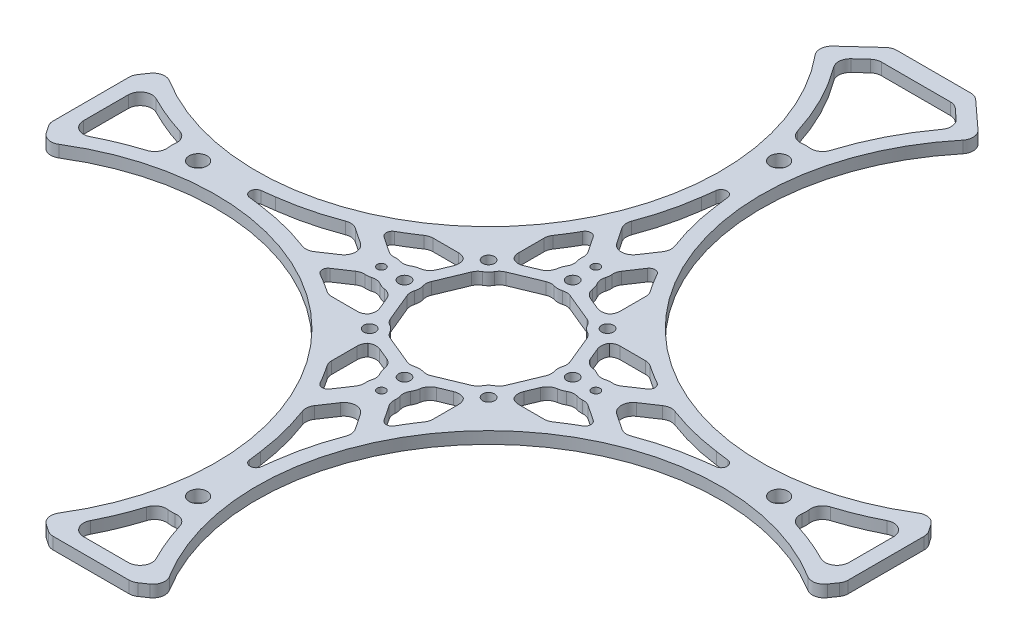
from build123d import *

# Parameters (mm, degrees)
SKETCH_1_R      = 1.5
SKETCH_1_R_2    = 1
SKETCH_1_R_3    = 0.7
EXTRUDE_1_DEPTH = 2
FILLET_1_R      = 2
FILLET_2_R      = 1
FILLET_3_R      = 2


with BuildPart() as part:
    # 草图1 → 凸台-拉伸1 (new body)
    with BuildSketch(Plane(origin=(0, 0, 0), x_dir=(1, 0, 0), z_dir=(0, 1, 0))):
        with BuildLine():
            Line((66.853027267, -7), (64.564685006, -10.318827685))
            ThreePointArc((64.564685006, -10.318827685), (14.849242405, -14.849242405), (10.318827685, -64.564685006))
            Line((10.318827685, -64.564685006), (7, -66.853027267))
            Line((7, -66.853027267), (-7, -66.853027267))
            Line((-7, -66.853027267), (-10.318827685, -64.564685006))
            ThreePointArc((-10.318827685, -64.564685006), (-14.849242405, -14.849242405), (-64.564685006, -10.318827685))
            Line((-64.564685006, -10.318827685), (-66.853027267, -7))
            Line((-66.853027267, -7), (-66.853027267, 7))
            Line((-66.853027267, 7), (-64.564685006, 10.318827685))
            ThreePointArc((-64.564685006, 10.318827685), (-13.01911022, 16.809791852), (-13.65827776, 68.758520043))
            Line((-13.65827776, 68.758520043), (-7, 74.853027267))
            Line((-7, 74.853027267), (7, 74.853027267))
            Line((7, 74.853027267), (13.65827776, 68.758520043))
            ThreePointArc((13.65827776, 68.758520043), (13.01911022, 16.809791852), (64.564685006, 10.318827685))
            Line((64.564685006, 10.318827685), (66.853027267, 7))
            Line((66.853027267, 7), (66.853027267, -7))
        make_face()
        with Locations(Location((0, 48.853027267, 0), (0, 0, 270))):
            Circle(SKETCH_1_R, mode=Mode.SUBTRACT)
        with Locations(Location((10, 10, 0), (0, 0, 270))):
            Circle(SKETCH_1_R_2, mode=Mode.SUBTRACT)
        with Locations(Location((0, 14.142135624, 0), (0, 0, 270))):
            Circle(SKETCH_1_R_2, mode=Mode.SUBTRACT)
        with Locations(Location((0, 18.03122292, 0), (0, 0, 270))):
            Circle(SKETCH_1_R_3, mode=Mode.SUBTRACT)
        with Locations(Location((-10, 10, 0), (0, 0, 270))):
            Circle(SKETCH_1_R_2, mode=Mode.SUBTRACT)
        with Locations(Location((10, -10, 0), (0, 0, 270))):
            Circle(SKETCH_1_R_2, mode=Mode.SUBTRACT)
        with Locations(Location((18.03122292, 0, 0), (0, 0, 270))):
            Circle(SKETCH_1_R_3, mode=Mode.SUBTRACT)
        with Locations(Location((14.142135624, 0, 0), (0, 0, 270))):
            Circle(SKETCH_1_R_2, mode=Mode.SUBTRACT)
        with Locations(Location((48.853027267, 0, 0), (0, 0, 270))):
            Circle(SKETCH_1_R, mode=Mode.SUBTRACT)
        with Locations(Location((0, -48.853027267, 0), (0, 0, 270))):
            Circle(SKETCH_1_R, mode=Mode.SUBTRACT)
        with Locations(Location((0, -14.142135624, 0), (0, 0, 270))):
            Circle(SKETCH_1_R_2, mode=Mode.SUBTRACT)
        with Locations(Location((0, -18.03122292, 0), (0, 0, 270))):
            Circle(SKETCH_1_R_3, mode=Mode.SUBTRACT)
        with Locations(Location((-18.03122292, 0, 0), (0, 0, 270))):
            Circle(SKETCH_1_R_3, mode=Mode.SUBTRACT)
        with Locations(Location((-14.142135624, 0, 0), (0, 0, 270))):
            Circle(SKETCH_1_R_2, mode=Mode.SUBTRACT)
        with Locations(Location((-10, -10, 0), (0, 0, 270))):
            Circle(SKETCH_1_R_2, mode=Mode.SUBTRACT)
        with Locations(Location((-48.853027267, 0, 0), (0, 0, 270))):
            Circle(SKETCH_1_R, mode=Mode.SUBTRACT)
        with BuildLine():
            Line((46.853027267, 0), (37.069796127, -1.273418107))
            ThreePointArc((37.069796127, -1.273418107), (31.808100936, -2.307667562), (26.723691278, -4.011746977))
            Line((26.723691278, -4.011746977), (20.728369538, 0.000140536))
            Line((20.728369538, 0.000140536), (26.723691278, 4.011746977))
            ThreePointArc((26.723691278, 4.011746977), (31.808100936, 2.307667562), (37.069796127, 1.273418107))
            Line((37.069796127, 1.273418107), (46.853027267, 0))
        make_face(mode=Mode.SUBTRACT)
        with BuildLine():
            Line((0, 46.853027267), (1.273418107, 37.069796127))
            ThreePointArc((1.273418107, 37.069796127), (2.307667562, 31.808100936), (4.011746977, 26.723691278))
            Line((4.011746977, 26.723691278), (-0.000140536, 20.728369538))
            Line((-0.000140536, 20.728369538), (-4.011746977, 26.723691278))
            ThreePointArc((-4.011746977, 26.723691278), (-2.307667562, 31.808100936), (-1.273418107, 37.069796127))
            Line((-1.273418107, 37.069796127), (0, 46.853027267))
        make_face(mode=Mode.SUBTRACT)
        with BuildLine():
            Line((1.273733916, 11.99094946), (7.578215786, 9.379547566))
            ThreePointArc((7.578215786, 9.379547566), (8.232233047, 8.232233047), (9.379547566, 7.578215786))
            Line((9.379547566, 7.578215786), (11.99094946, 1.273733916))
            ThreePointArc((11.99094946, 1.273733916), (11.642135624, 0), (11.99094946, -1.273733916))
            Line((11.99094946, -1.273733916), (9.379547566, -7.578215786))
            ThreePointArc((9.379547566, -7.578215786), (8.232233047, -8.232233047), (7.578215786, -9.379547566))
            Line((7.578215786, -9.379547566), (1.273733916, -11.99094946))
            ThreePointArc((1.273733916, -11.99094946), (0, -11.642135624), (-1.273733916, -11.99094946))
            Line((-1.273733916, -11.99094946), (-7.578215786, -9.379547566))
            ThreePointArc((-7.578215786, -9.379547566), (-8.232233047, -8.232233047), (-9.379547566, -7.578215786))
            Line((-9.379547566, -7.578215786), (-11.99094946, -1.273733916))
            ThreePointArc((-11.99094946, -1.273733916), (-11.642135624, 0), (-11.99094946, 1.273733916))
            Line((-11.99094946, 1.273733916), (-9.379547566, 7.578215786))
            ThreePointArc((-9.379547566, 7.578215786), (-8.232233047, 8.232233047), (-7.578215786, 9.379547566))
            Line((-7.578215786, 9.379547566), (-1.273733916, 11.99094946))
            ThreePointArc((-1.273733916, 11.99094946), (0, 11.642135624), (1.273733916, 11.99094946))
        make_face(mode=Mode.SUBTRACT)
        with BuildLine():
            Line((5.480874332, 23.524617924), (2.358912458, 18.859191528))
            ThreePointArc((2.358912458, 18.859191528), (2.461323943, 17.593176752), (1.928406078, 16.440232663))
            ThreePointArc((1.928406078, 16.440232663), (2.84419756, 15.096357946), (2.924214228, 13.472082531))
            Line((2.924214228, 13.472082531), (7.458469204, 11.593932625))
            ThreePointArc((7.458469204, 11.593932625), (7.926772471, 12.168346746), (8.521602403, 12.610429188))
            Line((8.521602403, 12.610429188), (8.521602403, 18.494958233))
            ThreePointArc((8.521602403, 18.494958233), (6.912086764, 20.955890638), (5.480874332, 23.524617924))
        make_face(mode=Mode.SUBTRACT)
        with BuildLine():
            Line((-8.521602403, 12.610429188), (-8.521602403, 18.494958233))
            ThreePointArc((-8.521602403, 18.494958233), (-6.912086764, 20.955890638), (-5.480874332, 23.524617924))
            Line((-5.480874332, 23.524617924), (-2.358912458, 18.859191528))
            ThreePointArc((-2.358912458, 18.859191528), (-2.461323943, 17.593176752), (-1.928406078, 16.440232663))
            ThreePointArc((-1.928406078, 16.440232663), (-2.84419756, 15.096357946), (-2.924214228, 13.472082531))
            Line((-2.924214228, 13.472082531), (-7.458469204, 11.593932625))
            ThreePointArc((-7.458469204, 11.593932625), (-7.926772471, 12.168346746), (-8.521602403, 12.610429188))
        make_face(mode=Mode.SUBTRACT)
        with BuildLine():
            Line((23.524617924, -5.480874332), (18.859191528, -2.358912458))
            ThreePointArc((18.859191528, -2.358912458), (17.593176752, -2.461323943), (16.440232663, -1.928406078))
            ThreePointArc((16.440232663, -1.928406078), (15.096357946, -2.84419756), (13.472082531, -2.924214228))
            Line((13.472082531, -2.924214228), (11.593932625, -7.458469204))
            ThreePointArc((11.593932625, -7.458469204), (12.168346746, -7.926772471), (12.610429188, -8.521602403))
            Line((12.610429188, -8.521602403), (18.494958233, -8.521602403))
            ThreePointArc((18.494958233, -8.521602403), (20.955890638, -6.912086764), (23.524617924, -5.480874332))
        make_face(mode=Mode.SUBTRACT)
        with BuildLine():
            Line((64.353027267, 7.191859648), (64.353027267, -7.191859648))
            ThreePointArc((64.353027267, -7.191859648), (58.745757156, -4.269771717), (52.759651879, -2.233446696))
            ThreePointArc((52.759651879, -2.233446696), (53.353027267, 0), (52.759651879, 2.233446696))
            ThreePointArc((52.759651879, 2.233446696), (58.745757156, 4.269771717), (64.353027267, 7.191859648))
        make_face(mode=Mode.SUBTRACT)
        with BuildLine():
            Line((12.610429188, 8.521602403), (18.494958233, 8.521602403))
            ThreePointArc((18.494958233, 8.521602403), (20.955890638, 6.912086764), (23.524617924, 5.480874332))
            Line((23.524617924, 5.480874332), (18.859191528, 2.358912458))
            ThreePointArc((18.859191528, 2.358912458), (17.593176752, 2.461323943), (16.440232663, 1.928406078))
            ThreePointArc((16.440232663, 1.928406078), (15.096357946, 2.84419756), (13.472082531, 2.924214228))
            Line((13.472082531, 2.924214228), (11.593932625, 7.458469204))
            ThreePointArc((11.593932625, 7.458469204), (12.168346746, 7.926772471), (12.610429188, 8.521602403))
        make_face(mode=Mode.SUBTRACT)
        with BuildLine():
            Line((0, -46.853027267), (-1.273418107, -37.069796127))
            ThreePointArc((-1.273418107, -37.069796127), (-2.307667562, -31.808100936), (-4.011746977, -26.723691278))
            Line((-4.011746977, -26.723691278), (0.000140536, -20.728369538))
            Line((0.000140536, -20.728369538), (4.011746977, -26.723691278))
            ThreePointArc((4.011746977, -26.723691278), (2.307667562, -31.808100936), (1.273418107, -37.069796127))
            Line((1.273418107, -37.069796127), (0, -46.853027267))
        make_face(mode=Mode.SUBTRACT)
        with BuildLine():
            Line((-5.480874332, -23.524617924), (-2.358912458, -18.859191528))
            ThreePointArc((-2.358912458, -18.859191528), (-2.461323943, -17.593176752), (-1.928406078, -16.440232663))
            ThreePointArc((-1.928406078, -16.440232663), (-2.84419756, -15.096357946), (-2.924214228, -13.472082531))
            Line((-2.924214228, -13.472082531), (-7.458469204, -11.593932625))
            ThreePointArc((-7.458469204, -11.593932625), (-7.926772471, -12.168346746), (-8.521602403, -12.610429188))
            Line((-8.521602403, -12.610429188), (-8.521602403, -18.494958233))
            ThreePointArc((-8.521602403, -18.494958233), (-6.912086764, -20.955890638), (-5.480874332, -23.524617924))
        make_face(mode=Mode.SUBTRACT)
        with BuildLine():
            Line((-7.191859648, -64.353027267), (7.191859648, -64.353027267))
            ThreePointArc((7.191859648, -64.353027267), (4.269771717, -58.745757156), (2.233446696, -52.759651879))
            ThreePointArc((2.233446696, -52.759651879), (0, -53.353027267), (-2.233446696, -52.759651879))
            ThreePointArc((-2.233446696, -52.759651879), (-4.269771717, -58.745757156), (-7.191859648, -64.353027267))
        make_face(mode=Mode.SUBTRACT)
        with BuildLine():
            Line((8.521602403, -12.610429188), (8.521602403, -18.494958233))
            ThreePointArc((8.521602403, -18.494958233), (6.912086764, -20.955890638), (5.480874332, -23.524617924))
            Line((5.480874332, -23.524617924), (2.358912458, -18.859191528))
            ThreePointArc((2.358912458, -18.859191528), (2.461323943, -17.593176752), (1.928406078, -16.440232663))
            ThreePointArc((1.928406078, -16.440232663), (2.84419756, -15.096357946), (2.924214228, -13.472082531))
            Line((2.924214228, -13.472082531), (7.458469204, -11.593932625))
            ThreePointArc((7.458469204, -11.593932625), (7.926772471, -12.168346746), (8.521602403, -12.610429188))
        make_face(mode=Mode.SUBTRACT)
        with BuildLine():
            Line((-46.853027267, 0), (-37.069796127, 1.273418107))
            ThreePointArc((-37.069796127, 1.273418107), (-31.808100936, 2.307667562), (-26.723691278, 4.011746977))
            Line((-26.723691278, 4.011746977), (-20.728369538, -0.000140536))
            Line((-20.728369538, -0.000140536), (-26.723691278, -4.011746977))
            ThreePointArc((-26.723691278, -4.011746977), (-31.808100936, -2.307667562), (-37.069796127, -1.273418107))
            Line((-37.069796127, -1.273418107), (-46.853027267, 0))
        make_face(mode=Mode.SUBTRACT)
        with BuildLine():
            Line((-23.524617924, 5.480874332), (-18.859191528, 2.358912458))
            ThreePointArc((-18.859191528, 2.358912458), (-17.593176752, 2.461323943), (-16.440232663, 1.928406078))
            ThreePointArc((-16.440232663, 1.928406078), (-15.096357946, 2.84419756), (-13.472082531, 2.924214228))
            Line((-13.472082531, 2.924214228), (-11.593932625, 7.458469204))
            ThreePointArc((-11.593932625, 7.458469204), (-12.168346746, 7.926772471), (-12.610429188, 8.521602403))
            Line((-12.610429188, 8.521602403), (-18.494958233, 8.521602403))
            ThreePointArc((-18.494958233, 8.521602403), (-20.955890638, 6.912086764), (-23.524617924, 5.480874332))
        make_face(mode=Mode.SUBTRACT)
        with BuildLine():
            Line((-64.353027267, -7.191859648), (-64.353027267, 7.191859648))
            ThreePointArc((-64.353027267, 7.191859648), (-58.745757156, 4.269771717), (-52.759651879, 2.233446696))
            ThreePointArc((-52.759651879, 2.233446696), (-53.353027267, 0), (-52.759651879, -2.233446696))
            ThreePointArc((-52.759651879, -2.233446696), (-58.745757156, -4.269771717), (-64.353027267, -7.191859648))
        make_face(mode=Mode.SUBTRACT)
        with BuildLine():
            Line((-12.610429188, -8.521602403), (-18.494958233, -8.521602403))
            ThreePointArc((-18.494958233, -8.521602403), (-20.955890638, -6.912086764), (-23.524617924, -5.480874332))
            Line((-23.524617924, -5.480874332), (-18.859191528, -2.358912458))
            ThreePointArc((-18.859191528, -2.358912458), (-17.593176752, -2.461323943), (-16.440232663, -1.928406078))
            ThreePointArc((-16.440232663, -1.928406078), (-15.096357946, -2.84419756), (-13.472082531, -2.924214228))
            Line((-13.472082531, -2.924214228), (-11.593932625, -7.458469204))
            ThreePointArc((-11.593932625, -7.458469204), (-12.168346746, -7.926772471), (-12.610429188, -8.521602403))
        make_face(mode=Mode.SUBTRACT)
        with BuildLine():
            Line((-10.181682153, 68.55158469), (-6.574840635, 71.853027267))
            Line((-6.574840635, 71.853027267), (6.574840635, 71.853027267))
            Line((6.574840635, 71.853027267), (10.181682153, 68.55158469))
            ThreePointArc((10.181682153, 68.55158469), (5.356863136, 61.083784629), (2.233446696, 52.759651879))
            ThreePointArc((2.233446696, 52.759651879), (0, 53.353027267), (-2.233446696, 52.759651879))
            ThreePointArc((-2.233446696, 52.759651879), (-5.356863136, 61.083784629), (-10.181682153, 68.55158469))
        make_face(mode=Mode.SUBTRACT)
    extrude(amount=EXTRUDE_1_DEPTH)

    # 圆角1
    # the kernel refuses this fillet: 2 mm, written as the material it adds along each edge
    with BuildSketch(Plane(origin=(2.233446696, 0, -52.759651879), x_dir=(0.2724835154432386, 0, -0.9621604511783335), z_dir=(0, 1, 0))) as fillet_1_piece_1:
        with BuildLine():
            CenterArc((2.067903732, 1.999408044), FILLET_1_R, 188.092047085, 80.51390334)
            ThreePointArc((0.087817321, 1.717880422), (0.126754668, 0.854705158), (0, 0))
            ThreePointArc((0, 0), (1.009623512, 0.012283057), (2.019247023, 0))
        make_face()
    fillet_1_piece_1_solid = extrude(amount=2, mode=Mode.PRIVATE)
    with BuildSketch(Plane(origin=(10.181682153, 0, -68.55158469), x_dir=(-0.6125346865860347, 0, 0.7904437093993146), z_dir=(0, 1, 0))) as fillet_1_piece_2:
        with BuildLine():
            CenterArc((1.842494254, -1.999530075), FILLET_1_R, 91.242067532, 84.062199416)
            Line((-0.150792718, -1.835801502), (0, 0))
            ThreePointArc((0, 0), (0.899570657, -0.009750904), (1.799141314, 0))
        make_face()
    fillet_1_piece_2_solid = extrude(amount=2, mode=Mode.PRIVATE)
    with BuildSketch(Plane(origin=(6.574840635, 0, -71.853027267), x_dir=(0.7376458590862239, 0, 0.6751878157764303), z_dir=(0, 1, 0)), Plane(origin=(-6.574840635, 0, -71.853027267), x_dir=(1, 0, 0), z_dir=(0, 1, 0))) as fillet_1_piece_3:
        with BuildLine():
            CenterArc((FILLET_1_R * 0.388564684942, -FILLET_1_R), FILLET_1_R, 90, 42.468736876)
            Line((-FILLET_1_R * 0.286623130835, -FILLET_1_R * 0.262354140914), (0, 0))
            Line((0, 0), (FILLET_1_R * 0.388564684942, 0))
        make_face()
    fillet_1_piece_3_solid = extrude(amount=2, mode=Mode.PRIVATE)
    with BuildSketch(Plane(origin=(-10.181682153, 0, -68.55158469), x_dir=(0.7376458590862244, 0, -0.6751878157764297), z_dir=(0, 1, 0))) as fillet_1_piece_4:
        with BuildLine():
            CenterArc((1.841984148, -2), FILLET_1_R, 90, 84.062199416)
            ThreePointArc((-0.14728542, -1.793102472), (-0.063924535, -0.897349487), (0, 0))
            Line((0, 0), (1.841984148, 0))
        make_face()
    fillet_1_piece_4_solid = extrude(amount=2, mode=Mode.PRIVATE)
    with BuildSketch(Plane(origin=(-2.233446696, 0, -52.759651879), x_dir=(-0.27248351544323884, 0, -0.9621604511783335), z_dir=(0, 1, 0))) as fillet_1_piece_5:
        with BuildLine():
            CenterArc((2.067903732, -1.999408044), FILLET_1_R, 91.394049575, 80.51390334)
            ThreePointArc((0.087817321, -1.717880422), (0.126754668, -0.854705158), (0, 0))
            ThreePointArc((0, 0), (1.009623512, -0.012283057), (2.019247023, 0))
        make_face()
    fillet_1_piece_5_solid = extrude(amount=2, mode=Mode.PRIVATE)
    with BuildSketch(Plane(origin=(-2.233446696, 0, 52.759651879), x_dir=(0.9469947360581661, 0, 0.32124907762999766), z_dir=(0, 1, 0)), Plane(origin=(-52.759651879, 0, -2.233446696), x_dir=(-0.3212490776318856, 0, 0.9469947360575257), z_dir=(0, 1, 0))) as fillet_1_piece_6:
        with BuildLine():
            CenterArc((2.102375517, -1.963131393), FILLET_1_R, 101.018447934, 80.513957406)
            ThreePointArc((0.103090798, -2.016616053), (0.063812427, -1.007680928), (0, 0))
            ThreePointArc((0, 0), (0.860062712, -0.082954366), (1.720125423, 0))
        make_face()
    fillet_1_piece_6_solid = extrude(amount=2, mode=Mode.PRIVATE)
    with BuildSketch(Plane(origin=(-7.191859648, 0, 64.353027267), x_dir=(0.493620751852635, 0, -0.8696772696468728), z_dir=(0, 1, 0)), Plane(origin=(64.353027267, 0, 7.191859648), x_dir=(-0.8696772696468735, 0, -0.49362075185263343), z_dir=(0, 1, 0)), Plane(origin=(-64.353027267, 0, -7.191859648), x_dir=(0.8696772696468354, 0, 0.4936207518527006), z_dir=(0, 1, 0))) as fillet_1_piece_7:
        with BuildLine():
            CenterArc((3.433958355, -1.998367213), FILLET_1_R, 92.315351534, 117.263490677)
            Line((1.694603816, -2.985608717), (0, 0))
            ThreePointArc((0, 0), (1.676579667, -0.033880328), (3.353159335, 0))
        make_face()
    fillet_1_piece_7_solid = extrude(amount=2, mode=Mode.PRIVATE)
    with BuildSketch(Plane(origin=(7.191859648, 0, 64.353027267), x_dir=(-1, 0, 0), z_dir=(0, 1, 0)), Plane(origin=(64.353027267, 0, -7.191859648), x_dir=(0, 0, 1), z_dir=(0, 1, 0)), Plane(origin=(-64.353027267, 0, 7.191859648), x_dir=(0, 0, -1), z_dir=(0, 1, 0))) as fillet_1_piece_8:
        with BuildLine():
            CenterArc((3.433007647, -2), FILLET_1_R, 90, 117.263490677)
            ThreePointArc((1.655189032, -2.916166455), (0.857059467, -1.441359194), (0, 0))
            Line((0, 0), (3.433007647, 0))
        make_face()
    fillet_1_piece_8_solid = extrude(amount=2, mode=Mode.PRIVATE)
    with BuildSketch(Plane(origin=(2.233446696, 0, 52.759651879), x_dir=(-0.9469947360573733, 0, 0.32124907763233457), z_dir=(0, 1, 0)), Plane(origin=(-52.759651879, 0, 2.233446696), x_dir=(-0.3212490776319088, 0, -0.9469947360575178), z_dir=(0, 1, 0))) as fillet_1_piece_9:
        with BuildLine():
            CenterArc((2.102375517, 1.963131393), FILLET_1_R, 178.46759466, 80.513957406)
            ThreePointArc((0.103090798, 2.016616053), (0.063812427, 1.007680928), (0, 0))
            ThreePointArc((0, 0), (0.860062712, 0.082954366), (1.720125423, 0))
        make_face()
    fillet_1_piece_9_solid = extrude(amount=2, mode=Mode.PRIVATE)
    with BuildSketch(Plane(origin=(18.859191528, 0, -2.358912458), x_dir=(-0.9772420897089865, 0, -0.21212708007515946), z_dir=(0, 1, 0)), Plane(origin=(-2.358912458, 0, -18.859191528), x_dir=(-0.2121270800735347, 0, 0.9772420897093392), z_dir=(0, 1, 0)), Plane(origin=(2.358912458, 0, 18.859191528), x_dir=(0.21212708007388204, 0, -0.9772420897092637), z_dir=(0, 1, 0)), Plane(origin=(-18.859191528, 0, 2.358912458), x_dir=(0.9772420897092593, 0, 0.21212708007390285), z_dir=(0, 1, 0)), Plane(origin=(-11.99094946, 0, 1.273733916), x_dir=(0.39932954536130255, 0, -0.9168074575403143), z_dir=(0, 1, 0)), Plane(origin=(-7.578215786, 0, 9.379547566), x_dir=(-0.3659121408160593, 0, -0.930649399722263), z_dir=(0, 1, 0)), Plane(origin=(1.273733916, 0, 11.99094946), x_dir=(-0.9168074575403723, 0, -0.39932954536116966), z_dir=(0, 1, 0)), Plane(origin=(9.379547566, 0, 7.578215786), x_dir=(-0.9306493997223897, 0, 0.3659121408157371), z_dir=(0, 1, 0)), Plane(origin=(11.99094946, 0, -1.273733916), x_dir=(-0.39932954536152976, 0, 0.9168074575402155), z_dir=(0, 1, 0)), Plane(origin=(7.578215786, 0, -9.379547566), x_dir=(0.36591214081699736, 0, 0.9306493997218941), z_dir=(0, 1, 0)), Plane(origin=(-1.273733916, 0, -11.99094946), x_dir=(0.9168074575404345, 0, 0.3993295453610265), z_dir=(0, 1, 0)), Plane(origin=(-9.379547566, 0, -7.578215786), x_dir=(0.9306493997223069, 0, -0.3659121408159476), z_dir=(0, 1, 0))) as fillet_1_piece_10:
        with BuildLine():
            CenterArc((0.86446237, -1.984690482), FILLET_1_R, 97.093830543, 38.942441269)
            Line((-0.575096466, -0.596284794), (0, 0))
            ThreePointArc((0, 0), (0.308736561, -0.019136897), (0.617473122, 0))
        make_face()
    fillet_1_piece_10_solid = extrude(amount=2, mode=Mode.PRIVATE)
    with BuildSketch(Plane(origin=(18.494958233, 0, -8.521602403), x_dir=(0.8212128442854213, 0, 0.5706219978064712), z_dir=(0, 1, 0)), Plane(origin=(-8.521602403, 0, -18.494958233), x_dir=(0.5706219978057088, 0, -0.821212844285951), z_dir=(0, 1, 0)), Plane(origin=(8.521602403, 0, 18.494958233), x_dir=(-0.5706219978055845, 0, 0.8212128442860372), z_dir=(0, 1, 0)), Plane(origin=(-18.494958233, 0, 8.521602403), x_dir=(-0.8212128442859563, 0, -0.5706219978057011), z_dir=(0, 1, 0))) as fillet_1_piece_11:
        with BuildLine():
            CenterArc((0.626717787, -1.999945636), FILLET_1_R, 90.42245423, 34.371156719)
            Line((-0.514526208, -0.357519947), (0, 0))
            ThreePointArc((0, 0), (0.305985743, -0.001128055), (0.611971487, 0))
        make_face()
    fillet_1_piece_11_solid = extrude(amount=2, mode=Mode.PRIVATE)
    with BuildSketch(Plane(origin=(12.610429188, 0, -8.521602403), x_dir=(1, 0, 0), z_dir=(0, 1, 0)), Plane(origin=(-12.610429188, 0, 8.521602403), x_dir=(-1, 0, 0), z_dir=(0, 1, 0))) as fillet_1_piece_12:
        with BuildLine():
            CenterArc((0.98133224, -2), FILLET_1_R, 90, 45.918609109)
            ThreePointArc((-0.455372331, -0.608640961), (-0.208331091, -0.318801539), (0, 0))
            Line((0, 0), (0.98133224, 0))
        make_face()
    fillet_1_piece_12_solid = extrude(amount=2, mode=Mode.PRIVATE)
    with BuildSketch(Plane(origin=(11.593932625, 0, -7.458469204), x_dir=(0.7396659321344101, 0, -0.6729742259847209), z_dir=(0, 1, 0)), Plane(origin=(13.472082531, 0, 2.924214228), x_dir=(0.998887435182428, 0, 0.047158157668325214), z_dir=(0, 1, 0)), Plane(origin=(2.924214228, 0, -13.472082531), x_dir=(0.04715815766733914, 0, -0.9988874351824746), z_dir=(0, 1, 0)), Plane(origin=(-7.458469204, 0, -11.593932625), x_dir=(-0.6729742259848317, 0, -0.7396659321343093), z_dir=(0, 1, 0)), Plane(origin=(-2.924214228, 0, 13.472082531), x_dir=(-0.0471581576667334, 0, 0.9988874351825032), z_dir=(0, 1, 0)), Plane(origin=(7.458469204, 0, 11.593932625), x_dir=(0.6729742259848859, 0, 0.7396659321342601), z_dir=(0, 1, 0)), Plane(origin=(-13.472082531, 0, -2.924214228), x_dir=(-0.9988874351824718, 0, -0.0471581576673953), z_dir=(0, 1, 0))) as fillet_1_piece_13:
        with BuildLine():
            CenterArc((1.417085492, -1.96837288), FILLET_1_R, 100.202965887, 60)
            Line((-0.464711113, -1.290994449), (0, 0))
            ThreePointArc((0, 0), (0.531407059, -0.04744068), (1.062814119, 0))
        make_face()
    fillet_1_piece_13_solid = extrude(amount=2, mode=Mode.PRIVATE)
    with BuildSketch(Plane(origin=(13.472082531, 0, -2.924214228), x_dir=(0.9988874351824754, 0, -0.04715815766732463), z_dir=(0, 1, 0))) as fillet_1_piece_14:
        with BuildLine():
            CenterArc((1.417085492, 1.96837288), FILLET_1_R, 199.797034113, 60)
            Line((-0.464711113, 1.290994449), (0, 0))
            ThreePointArc((0, 0), (0.531407059, 0.04744068), (1.062814119, 0))
        make_face()
    fillet_1_piece_14_solid = extrude(amount=2, mode=Mode.PRIVATE)
    with BuildSketch(Plane(origin=(16.440232663, 0, -1.928406078), x_dir=(-0.7619204740055726, 0, -0.6476705885642202), z_dir=(0, 1, 0)), Plane(origin=(-1.928406078, 0, -16.440232663), x_dir=(-0.6476705885637628, 0, 0.7619204740059614), z_dir=(0, 1, 0)), Plane(origin=(1.928406078, 0, 16.440232663), x_dir=(0.6476705885640786, 0, -0.7619204740056931), z_dir=(0, 1, 0)), Plane(origin=(-16.440232663, 0, 1.928406078), x_dir=(0.7619204740056669, 0, 0.6476705885641093), z_dir=(0, 1, 0))) as fillet_1_piece_15:
        with BuildLine():
            CenterArc((1.338654096, -1.97180129), FILLET_1_R, 99.632718141, 47.975798771)
            ThreePointArc((-0.350161036, -0.900398727), (-0.131173495, -0.467274608), (0, 0))
            ThreePointArc((0, 0), (0.501995286, -0.042298066), (1.003990572, 0))
        make_face()
    fillet_1_piece_15_solid = extrude(amount=2, mode=Mode.PRIVATE)
    with BuildSketch(Plane(origin=(52.759651879, 0, 2.233446696), x_dir=(0.9621608105736081, 0, 0.27248224638742535), z_dir=(0, 1, 0))) as fillet_1_piece_16:
        with BuildLine():
            CenterArc((2.067905981, 1.999408046), FILLET_1_R, 188.091995819, 80.513957406)
            ThreePointArc((0.087819318, 1.717882196), (0.126755844, 0.854705944), (0, 0))
            ThreePointArc((0, 0), (1.009624685, 0.012283047), (2.01924937, 0))
        make_face()
    fillet_1_piece_16_solid = extrude(amount=2, mode=Mode.PRIVATE)
    with BuildSketch(Plane(origin=(52.759651879, 0, -2.233446696), x_dir=(0.9621608105735762, 0, -0.27248224638753754), z_dir=(0, 1, 0))) as fillet_1_piece_17:
        with BuildLine():
            CenterArc((2.067905981, -1.999408046), FILLET_1_R, 91.394046775, 80.513957406)
            ThreePointArc((0.087819318, -1.717882196), (0.126755844, -0.854705944), (0, 0))
            ThreePointArc((0, 0), (1.009624685, -0.012283047), (2.01924937, 0))
        make_face()
    fillet_1_piece_17_solid = extrude(amount=2, mode=Mode.PRIVATE)
    with BuildSketch(Plane(origin=(18.859191528, 0, 2.358912458), x_dir=(0.8310889444733288, 0, 0.5561395206009083), z_dir=(0, 1, 0)), Plane(origin=(2.358912458, 0, -18.859191528), x_dir=(0.5561395206008972, 0, -0.8310889444733363), z_dir=(0, 1, 0)), Plane(origin=(-2.358912458, 0, 18.859191528), x_dir=(-0.5561395206009203, 0, 0.8310889444733208), z_dir=(0, 1, 0)), Plane(origin=(-18.859191528, 0, -2.358912458), x_dir=(-0.8310889444733129, 0, -0.5561395206009321), z_dir=(0, 1, 0)), Plane(origin=(-9.379547566, 0, 7.578215786), x_dir=(-0.3826834323650518, 0, -0.9238795325113025), z_dir=(0, 1, 0)), Plane(origin=(-1.273733916, 0, 11.99094946), x_dir=(-0.9238795325112773, 0, -0.38268343236511254), z_dir=(0, 1, 0)), Plane(origin=(7.578215786, 0, 9.379547566), x_dir=(-0.9238795325112974, 0, 0.38268343236506414), z_dir=(0, 1, 0)), Plane(origin=(11.99094946, 0, 1.273733916), x_dir=(-0.38268343236510166, 0, 0.9238795325112817), z_dir=(0, 1, 0)), Plane(origin=(9.379547566, 0, -7.578215786), x_dir=(0.3826834323650756, 0, 0.9238795325112925), z_dir=(0, 1, 0)), Plane(origin=(-7.578215786, 0, -9.379547566), x_dir=(0.9238795325112871, 0, -0.382683432365089), z_dir=(0, 1, 0)), Plane(origin=(-11.99094946, 0, -1.273733916), x_dir=(0.38268343236512803, 0, -0.9238795325112709), z_dir=(0, 1, 0))) as fillet_1_piece_18:
        with BuildLine():
            CenterArc((0.828427125, -2), FILLET_1_R, 90, 38.942441269)
            ThreePointArc((-0.428651597, -0.444444444), (-0.200551454, -0.235507111), (0, 0))
            Line((0, 0), (0.828427125, 0))
        make_face()
    fillet_1_piece_18_solid = extrude(amount=2, mode=Mode.PRIVATE)
    with BuildSketch(Plane(origin=(16.440232663, 0, 1.928406078), x_dir=(0.8797899815372116, 0, 0.47536258622945193), z_dir=(0, 1, 0)), Plane(origin=(1.928406078, 0, -16.440232663), x_dir=(0.47536258623153294, 0, -0.879789981536087), z_dir=(0, 1, 0)), Plane(origin=(-1.928406078, 0, 16.440232663), x_dir=(-0.4753625862306751, 0, 0.8797899815365506), z_dir=(0, 1, 0)), Plane(origin=(-16.440232663, 0, -1.928406078), x_dir=(-0.8797899815365031, 0, -0.4753625862307629), z_dir=(0, 1, 0))) as fillet_1_piece_19:
        with BuildLine():
            CenterArc((1.352526529, -1.962311673), FILLET_1_R, 101.140647296, 47.975798771)
            ThreePointArc((-0.363898023, -0.935721805), (-0.142527105, -0.483191906), (0, 0))
            ThreePointArc((0, 0), (0.483045189, -0.047110409), (0.966090378, 0))
        make_face()
    fillet_1_piece_19_solid = extrude(amount=2, mode=Mode.PRIVATE)
    with BuildSketch(Plane(origin=(11.593932625, 0, 7.458469204), x_dir=(0.3826834323651023, 0, -0.9238795325112815), z_dir=(0, 1, 0)), Plane(origin=(7.458469204, 0, -11.593932625), x_dir=(-0.9238795325112871, 0, -0.382683432365089), z_dir=(0, 1, 0)), Plane(origin=(-2.924214228, 0, -13.472082531), x_dir=(-0.9238795325112865, 0, 0.38268343236509017), z_dir=(0, 1, 0)), Plane(origin=(-7.458469204, 0, 11.593932625), x_dir=(0.9238795325111385, 0, 0.3826834323654475), z_dir=(0, 1, 0)), Plane(origin=(2.924214228, 0, 13.472082531), x_dir=(0.9238795325112972, 0, -0.3826834323650646), z_dir=(0, 1, 0)), Plane(origin=(-11.593932625, 0, -7.458469204), x_dir=(-0.3826834323649728, 0, 0.9238795325113353), z_dir=(0, 1, 0)), Plane(origin=(-13.472082531, 0, 2.924214228), x_dir=(0.38268343236505054, 0, 0.923879532511303), z_dir=(0, 1, 0))) as fillet_1_piece_20:
        with BuildLine():
            CenterArc((1.372087127, -2), FILLET_1_R, 90, 60)
            ThreePointArc((-0.35996368, -1), (-0.135344985, -0.516067647), (0, 0))
            Line((0, 0), (1.372087127, 0))
        make_face()
    fillet_1_piece_20_solid = extrude(amount=2, mode=Mode.PRIVATE)
    with BuildSketch(Plane(origin=(12.610429188, 0, 8.521602403), x_dir=(-0.599066378765807, 0, -0.8006993654502437), z_dir=(0, 1, 0)), Plane(origin=(8.521602403, 0, -12.610429188), x_dir=(-0.8006993654504777, 0, 0.5990663787654941), z_dir=(0, 1, 0)), Plane(origin=(-8.521602403, 0, 12.610429188), x_dir=(0.8006993654504903, 0, -0.5990663787654773), z_dir=(0, 1, 0)), Plane(origin=(-12.610429188, 0, -8.521602403), x_dir=(0.5990663787644638, 0, 0.8006993654512484), z_dir=(0, 1, 0))) as fillet_1_piece_21:
        with BuildLine():
            CenterArc((1.013515579, -1.983884859), FILLET_1_R, 97.278329719, 45.918609109)
            Line((-0.587883151, -0.785752102), (0, 0))
            ThreePointArc((0, 0), (0.380068342, -0.024172711), (0.760136685, 0))
        make_face()
    fillet_1_piece_21_solid = extrude(amount=2, mode=Mode.PRIVATE)
    with BuildSketch(Plane(origin=(18.494958233, 0, 8.521602403), x_dir=(-1, 0, 0), z_dir=(0, 1, 0)), Plane(origin=(8.521602403, 0, -18.494958233), x_dir=(0, 0, 1), z_dir=(0, 1, 0)), Plane(origin=(-8.521602403, 0, 18.494958233), x_dir=(0, 0, -1), z_dir=(0, 1, 0)), Plane(origin=(-18.494958233, 0, -8.521602403), x_dir=(1, 0, 0), z_dir=(0, 1, 0))) as fillet_1_piece_22:
        with BuildLine():
            CenterArc((0.626544278, -2), FILLET_1_R, 90, 34.371156719)
            ThreePointArc((-0.502558845, -0.349204392), (-0.25063573, -0.175528569), (0, 0))
            Line((0, 0), (0.626544278, 0))
        make_face()
    fillet_1_piece_22_solid = extrude(amount=2, mode=Mode.PRIVATE)
    with BuildSketch(Plane(origin=(-8.521602403, 0, -12.610429188), x_dir=(0.8006993654511303, 0, 0.5990663787646218), z_dir=(0, 1, 0)), Plane(origin=(8.521602403, 0, 12.610429188), x_dir=(-0.8006993654505036, 0, -0.5990663787654594), z_dir=(0, 1, 0))) as fillet_1_piece_23:
        with BuildLine():
            CenterArc((1.013515579, 1.983884859), FILLET_1_R, 216.803061172, 45.918609109)
            Line((-0.587883151, 0.785752102), (0, 0))
            ThreePointArc((0, 0), (0.380068342, 0.024172711), (0.760136685, 0))
        make_face()
    fillet_1_piece_23_solid = extrude(amount=2, mode=Mode.PRIVATE)
    with BuildSketch(Plane(origin=(-11.593932625, 0, 7.458469204), x_dir=(-0.3826834323650515, 0, -0.9238795325113026), z_dir=(0, 1, 0))) as fillet_1_piece_24:
        with BuildLine():
            CenterArc((1.372087127, 2), FILLET_1_R, 210, 60)
            ThreePointArc((-0.35996368, 1), (-0.135344985, 0.516067647), (0, 0))
            Line((0, 0), (1.372087127, 0))
        make_face()
    fillet_1_piece_24_solid = extrude(amount=2, mode=Mode.PRIVATE)
    with BuildSketch(Plane(origin=(1.273733916, 0, -11.99094946), x_dir=(-0.9168074575402619, 0, 0.39932954536142307), z_dir=(0, 1, 0))) as fillet_1_piece_25:
        with BuildLine():
            CenterArc((0.86446237, 1.984690482), FILLET_1_R, 223.963728188, 38.942441269)
            Line((-0.575096466, 0.596284794), (0, 0))
            ThreePointArc((0, 0), (0.308736561, 0.019136897), (0.617473122, 0))
        make_face()
    fillet_1_piece_25_solid = extrude(amount=2, mode=Mode.PRIVATE)
    with BuildSketch(Plane(origin=(-26.723691278, 0, -4.011746977), x_dir=(0.8310889444732653, 0, 0.5561395206010032), z_dir=(0, 1, 0)), Plane(origin=(-4.011746977, 0, 26.723691278), x_dir=(0.5561395206009914, 0, -0.8310889444732733), z_dir=(0, 1, 0)), Plane(origin=(4.011746977, 0, -26.723691278), x_dir=(-0.5561395206009673, 0, 0.8310889444732893), z_dir=(0, 1, 0)), Plane(origin=(26.723691278, 0, 4.011746977), x_dir=(-0.8310889444732824, 0, -0.5561395206009777), z_dir=(0, 1, 0))) as fillet_1_piece_26:
        with BuildLine():
            CenterArc((1.047966548, -2), FILLET_1_R, 90, 54.609273295)
            ThreePointArc((-0.582476535, -0.841701527), (-0.288643112, -0.42264667), (0, 0))
            Line((0, 0), (1.047966548, 0))
        make_face()
    fillet_1_piece_26_solid = extrude(amount=2, mode=Mode.PRIVATE)
    with BuildSketch(Plane(origin=(-26.723691278, 0, 4.011746977), x_dir=(-0.9302468242049179, 0, -0.36693438930776806), z_dir=(0, 1, 0)), Plane(origin=(4.011746977, 0, 26.723691278), x_dir=(-0.36693438930775585, 0, 0.9302468242049226), z_dir=(0, 1, 0)), Plane(origin=(-4.011746977, 0, -26.723691278), x_dir=(0.36693438930772465, 0, -0.930246824204935), z_dir=(0, 1, 0)), Plane(origin=(26.723691278, 0, -4.011746977), x_dir=(0.9302468242049274, 0, 0.36693438930774386), z_dir=(0, 1, 0))) as fillet_1_piece_27:
        with BuildLine():
            CenterArc((1.048216096, -1.999847917), FILLET_1_R, 90.706586831, 54.607472747)
            Line((-0.596351323, -0.86169239), (0, 0))
            ThreePointArc((0, 0), (0.511776094, -0.00315572), (1.023552188, 0))
        make_face()
    fillet_1_piece_27_solid = extrude(amount=2, mode=Mode.PRIVATE)
    with BuildSketch(Plane(origin=(-20.728369538, 0, 0.000140536), x_dir=(-0.8311069531871567, 0, 0.5561126076290318), z_dir=(0, 1, 0)), Plane(origin=(0.000140536, 0, 20.728369538), x_dir=(0.5561126076290419, 0, 0.8311069531871499), z_dir=(0, 1, 0)), Plane(origin=(-0.000140536, 0, -20.728369538), x_dir=(-0.5561126076291523, 0, -0.831106953187076), z_dir=(0, 1, 0)), Plane(origin=(20.728369538, 0, -0.000140536), x_dir=(0.8311069531871232, 0, -0.5561126076290818), z_dir=(0, 1, 0))) as fillet_1_piece_28:
        with BuildLine():
            CenterArc((FILLET_1_R * 1.49444164275, -FILLET_1_R), FILLET_1_R, 90, 112.423379285)
            Line((FILLET_1_R * 0.57005118015, -FILLET_1_R * 1.38144760146), (0, 0))
            Line((0, 0), (FILLET_1_R * 1.49444164275, 0))
        make_face()
    fillet_1_piece_28_solid = extrude(amount=2, mode=Mode.PRIVATE)
    add([fillet_1_piece_1_solid, fillet_1_piece_2_solid, fillet_1_piece_3_solid, fillet_1_piece_4_solid, fillet_1_piece_5_solid, fillet_1_piece_6_solid, fillet_1_piece_7_solid, fillet_1_piece_8_solid, fillet_1_piece_9_solid, fillet_1_piece_10_solid, fillet_1_piece_11_solid, fillet_1_piece_12_solid, fillet_1_piece_13_solid, fillet_1_piece_14_solid, fillet_1_piece_15_solid, fillet_1_piece_16_solid, fillet_1_piece_17_solid, fillet_1_piece_18_solid, fillet_1_piece_19_solid, fillet_1_piece_20_solid, fillet_1_piece_21_solid, fillet_1_piece_22_solid, fillet_1_piece_23_solid, fillet_1_piece_24_solid, fillet_1_piece_25_solid, fillet_1_piece_26_solid, fillet_1_piece_27_solid, fillet_1_piece_28_solid])

    # 圆角2
    fillet_2_edges = [part.edges().sort_by_distance(p)[0] for p in [
        (23.524617924, 1, -5.480874332),
        (23.524617924, 1, 5.480874332),
        (5.480874332, 1, -23.524617924),
        (-5.480874332, 1, -23.524617924),
        (-5.480874332, 1, 23.524617924),
        (5.480874332, 1, 23.524617924),
        (-23.524617924, 1, -5.480874332),
        (-23.524617924, 1, 5.480874332),
        (-46.853027267, 1, 0),
        (0, 1, 46.853027267),
        (0, 1, -46.853027267),
        (46.853027267, 1, 0),
    ]]
    fillet(fillet_2_edges, radius=FILLET_2_R)

    # 圆角3
    fillet_3_edges = [part.edges().sort_by_distance(p)[0] for p in [
        (-13.65827776, 1, -68.758520043),
        (-7, 1, -74.853027267),
        (7, 1, -74.853027267),
        (13.65827776, 1, -68.758520043),
        (64.564685006, 1, -10.318827685),
        (66.853027267, 1, -7),
        (66.853027267, 1, 7),
        (64.564685006, 1, 10.318827685),
        (10.318827685, 1, 64.564685006),
        (7, 1, 66.853027267),
        (-7, 1, 66.853027267),
        (-10.318827685, 1, 64.564685006),
        (-64.564685006, 1, 10.318827685),
        (-66.853027267, 1, 7),
        (-66.853027267, 1, -7),
        (-64.564685006, 1, -10.318827685),
    ]]
    fillet(fillet_3_edges, radius=FILLET_3_R)


solid = part.part
